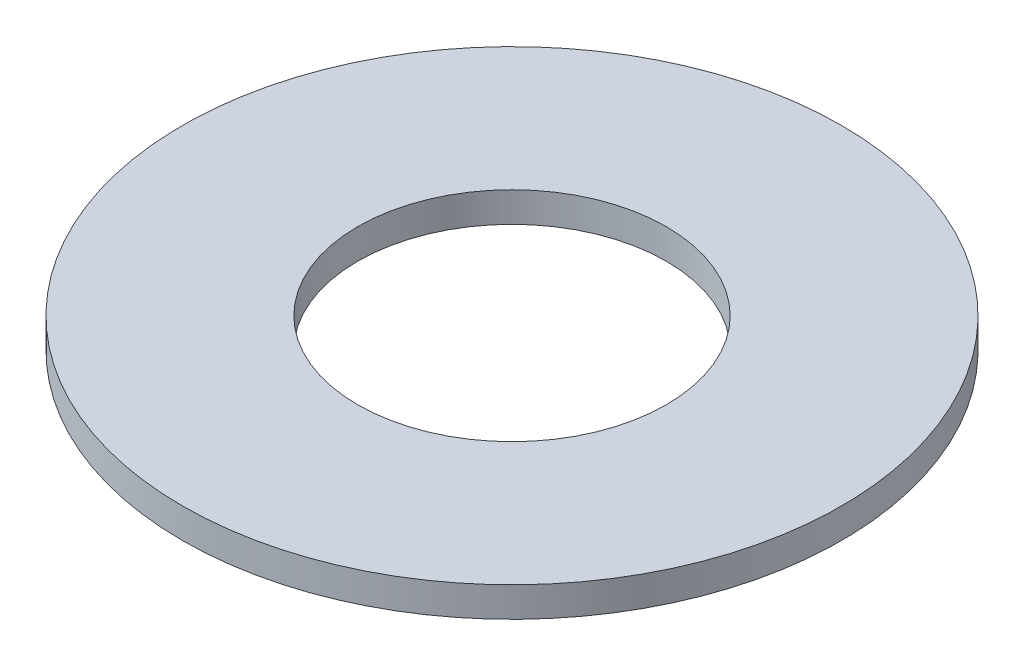
from build123d import *

# Parameters (mm, degrees)
SKETCH1_R           = 11
SKETCH1_R_2         = 5.15
BOSS_EXTRUDE1_DEPTH = 1


with BuildPart() as part:
    # Sketch1 → Boss-Extrude1 (new body)
    with BuildSketch(Plane(origin=(0, 0, 0), x_dir=(1, 0, 0), z_dir=(0, 1, 0))):
        Circle(SKETCH1_R)
        Circle(SKETCH1_R_2, mode=Mode.SUBTRACT)
    extrude(amount=BOSS_EXTRUDE1_DEPTH)


solid = part.part
